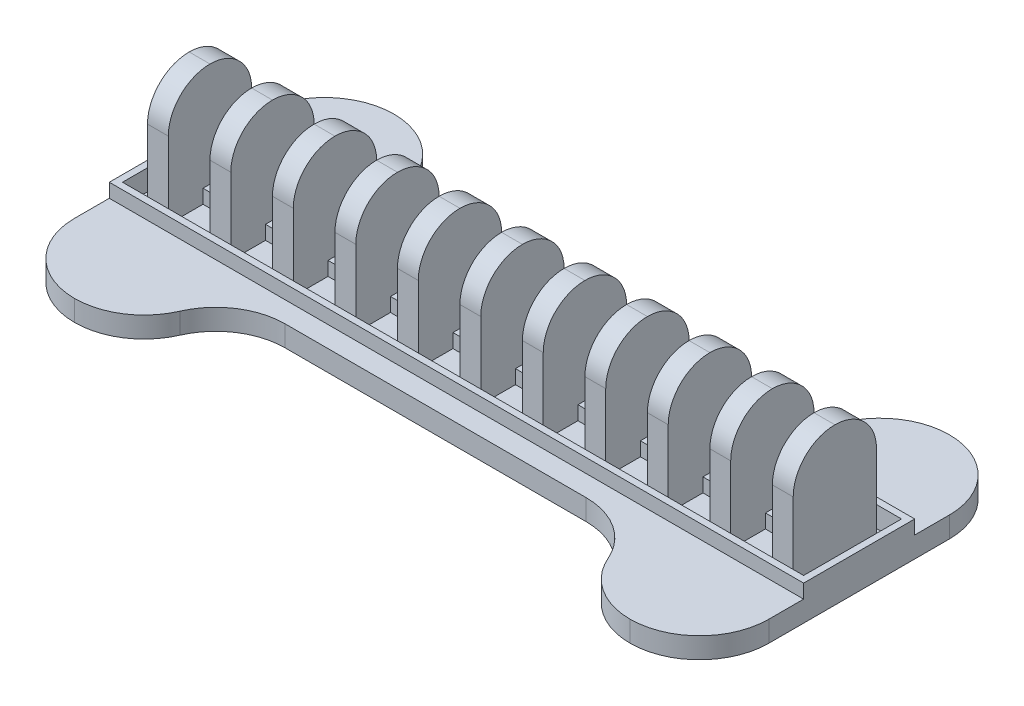
from build123d import *

# Parameters (mm, degrees)
SKETCH1_W            = 100
SKETCH1_H            = 16
BOSS_EXTRUDE1_DEPTH  = 3
SKETCH2_W            = 98
SKETCH2_H            = 14
CUT_EXTRUDE1_DEPTH   = 1
SKETCH5_W            = 20
SKETCH5_H            = 3
BOSS_EXTRUDE4_DEPTH  = 15
SKETCH6_W            = 20
SKETCH6_H            = 3
BOSS_EXTRUDE5_DEPTH  = 15
FILLET18_R           = 10
SKETCH7_W            = 3
SKETCH7_H            = 12
BOSS_EXTRUDE6_DEPTH  = 17
SKETCH8_W            = 6
SKETCH8_H            = 2
BOSS_EXTRUDE7_DEPTH  = 2
FILLET19_R           = 6
SKETCH10_W           = 60
SKETCH10_H           = 3
BOSS_EXTRUDE8_DEPTH  = 3
SKETCH11_W           = 60
SKETCH11_H           = 3
BOSS_EXTRUDE9_DEPTH  = 3
SKETCH12_W           = 0.95
SKETCH12_H           = 14
BOSS_EXTRUDE10_DEPTH = 3
SKETCH13_W           = 100
SKETCH13_H           = 0.95
BOSS_EXTRUDE11_DEPTH = 3
SKETCH14_W           = 0.95
SKETCH14_H           = 0.052088128
BOSS_EXTRUDE12_DEPTH = 3
SKETCH15_W           = 0.95
SKETCH15_H           = 0.047911872
SKETCH15_W_2         = 0.949734752
SKETCH15_H_2         = 0.052088128
BOSS_EXTRUDE13_DEPTH = 3
FILLET20_R           = 10
SKETCH17_W           = 98.1
SKETCH17_H           = 14.1
SKETCH17_W_2         = 97.1
SKETCH17_H_2         = 13.1
CUT_EXTRUDE2_DEPTH   = 4
SKETCH18_W           = 100
SKETCH18_H           = 16.05
SKETCH18_W_2         = 98
SKETCH18_H_2         = 14.05
CUT_EXTRUDE3_DEPTH   = 2
SKETCH19_W           = 100
SKETCH19_H           = 16
SKETCH19_W_2         = 98.1
SKETCH19_H_2         = 14.1
BOSS_EXTRUDE14_DEPTH = 1


with BuildPart() as part:
    # Sketch1 → Boss-Extrude1 (new body)
    with BuildSketch(Plane(origin=(0, 0, 0), x_dir=(1, 0, 0), z_dir=(0, 1, 0))):
        with Locations((50, 8)):
            Rectangle(SKETCH1_W, SKETCH1_H)
    extrude(amount=BOSS_EXTRUDE1_DEPTH)

    # Sketch2 → Cut-Extrude1 (cut)
    with BuildSketch(Plane(origin=(0, 3, 0), x_dir=(1, 0, 0), z_dir=(0, 1, 0))):
        with Locations((50, 8)):
            Rectangle(SKETCH2_W, SKETCH2_H)
    extrude(amount=-CUT_EXTRUDE1_DEPTH, mode=Mode.SUBTRACT)

    # Sketch5 → Boss-Extrude4 (add)
    with BuildSketch(Plane.XY):
        with Locations((10, 1.5)):
            Rectangle(SKETCH5_W, SKETCH5_H)
        with Locations((90, 1.5)):
            Rectangle(SKETCH5_W, SKETCH5_H)
    extrude(amount=BOSS_EXTRUDE4_DEPTH)

    # Sketch6 → Boss-Extrude5 (add)
    with BuildSketch(Plane(origin=(0, 0, -16), x_dir=(-1, 0, 0), z_dir=(0, 0, -1))):
        with Locations((-90, 1.5)):
            Rectangle(SKETCH6_W, SKETCH6_H)
        with Locations((-10, 1.5)):
            Rectangle(SKETCH6_W, SKETCH6_H)
    extrude(amount=BOSS_EXTRUDE5_DEPTH)

    # Fillet18
    fillet18_edges = [part.edges().sort_by_distance(p)[0] for p in [
        (20, 1.5, 15),
        (0, 1.5, 15),
        (80, 1.5, 15),
        (100, 1.5, 15),
        (0, 1.5, -31),
        (20, 1.5, -31),
        (80, 1.5, -31),
        (100, 1.5, -31),
    ]]
    fillet(fillet18_edges, radius=FILLET18_R - 0.0001)  # a hair under: the kernel refuses the full size

    # Sketch7 → Boss-Extrude6 (add)
    with BuildSketch(Plane(origin=(0, 2, 0), x_dir=(1, 0, 0), z_dir=(0, 1, 0))):
        with Locations((95, 8)):
            Rectangle(SKETCH7_W, SKETCH7_H)
        with Locations((86, 8)):
            Rectangle(SKETCH7_W, SKETCH7_H)
        with Locations((77, 8)):
            Rectangle(SKETCH7_W, SKETCH7_H)
        with Locations((68, 8)):
            Rectangle(SKETCH7_W, SKETCH7_H)
        with Locations((59, 8)):
            Rectangle(SKETCH7_W, SKETCH7_H)
        with Locations((50, 8)):
            Rectangle(SKETCH7_W, SKETCH7_H)
        with Locations((41, 8)):
            Rectangle(SKETCH7_W, SKETCH7_H)
        with Locations((32, 8)):
            Rectangle(SKETCH7_W, SKETCH7_H)
        with Locations((23, 8)):
            Rectangle(SKETCH7_W, SKETCH7_H)
        with Locations((14, 8)):
            Rectangle(SKETCH7_W, SKETCH7_H)
        with Locations((5, 8)):
            Rectangle(SKETCH7_W, SKETCH7_H)
    extrude(amount=BOSS_EXTRUDE6_DEPTH)

    # Sketch8 → Boss-Extrude7 (add)
    with BuildSketch(Plane(origin=(0, 2, 0), x_dir=(1, 0, 0), z_dir=(0, 1, 0))):
        with Locations((90.5, 8)):
            Rectangle(SKETCH8_W, SKETCH8_H)
        with Locations((81.5, 8)):
            Rectangle(SKETCH8_W, SKETCH8_H)
        with Locations((72.5, 8)):
            Rectangle(SKETCH8_W, SKETCH8_H)
        with Locations((63.5, 8)):
            Rectangle(SKETCH8_W, SKETCH8_H)
        with Locations((54.5, 8)):
            Rectangle(SKETCH8_W, SKETCH8_H)
        with Locations((45.5, 8)):
            Rectangle(SKETCH8_W, SKETCH8_H)
        with Locations((36.5, 8)):
            Rectangle(SKETCH8_W, SKETCH8_H)
        with Locations((27.5, 8)):
            Rectangle(SKETCH8_W, SKETCH8_H)
        with Locations((18.5, 8)):
            Rectangle(SKETCH8_W, SKETCH8_H)
        with Locations((9.5, 8)):
            Rectangle(SKETCH8_W, SKETCH8_H)
    extrude(amount=BOSS_EXTRUDE7_DEPTH)

    # Fillet19
    fillet19_edges = [part.edges().sort_by_distance(p)[0] for p in [
        (95, 19, -2),
        (95, 19, -14),
        (86, 19, -2),
        (86, 19, -14),
        (77, 19, -2),
        (77, 19, -14),
        (68, 19, -2),
        (68, 19, -14),
        (59, 19, -2),
        (59, 19, -14),
        (50, 19, -2),
        (50, 19, -14),
        (41, 19, -2),
        (41, 19, -14),
        (32, 19, -2),
        (32, 19, -14),
        (23, 19, -14),
        (23, 19, -2),
        (14, 19, -2),
        (14, 19, -14),
        (5, 19, -2),
        (5, 19, -14),
    ]]
    fillet(fillet19_edges, radius=FILLET19_R - 0.0001)  # a hair under: the kernel refuses the full size

    # Sketch10 → Boss-Extrude8 (add)
    with BuildSketch(Plane(origin=(0, 0, -16), x_dir=(-1, 0, 0), z_dir=(0, 0, -1))):
        with Locations((-50, 1.5)):
            Rectangle(SKETCH10_W, SKETCH10_H)
    extrude(amount=BOSS_EXTRUDE8_DEPTH)

    # Sketch11 → Boss-Extrude9 (add)
    with BuildSketch(Plane.XY):
        with Locations((50, 1.5)):
            Rectangle(SKETCH11_W, SKETCH11_H)
    extrude(amount=BOSS_EXTRUDE9_DEPTH)

    # Sketch12 → Boss-Extrude10 (add)
    with BuildSketch(Plane(origin=(0, 3, 0), x_dir=(1, 0, 0), z_dir=(0, 1, 0))):
        with Locations((99.525, 7.997911872)):
            Rectangle(SKETCH12_W, SKETCH12_H)
        with Locations((0.475, 7.997911872)):
            Rectangle(SKETCH12_W, SKETCH12_H)
    extrude(amount=BOSS_EXTRUDE10_DEPTH)

    # Sketch13 → Boss-Extrude11 (add)
    with BuildSketch(Plane(origin=(0, 3, 0), x_dir=(1, 0, 0), z_dir=(0, 1, 0))):
        with Locations((50, 15.525)):
            Rectangle(SKETCH13_W, SKETCH13_H)
        with Locations((50, 0.475)):
            Rectangle(SKETCH13_W, SKETCH13_H)
    extrude(amount=BOSS_EXTRUDE11_DEPTH)

    # Sketch14 → Boss-Extrude12 (add)
    with BuildSketch(Plane(origin=(0, 3, 0), x_dir=(1, 0, 0), z_dir=(0, 1, 0))):
        with Locations((0.475, 15.023955936)):
            Rectangle(SKETCH14_W, SKETCH14_H)
    extrude(amount=BOSS_EXTRUDE12_DEPTH)

    # Sketch15 → Boss-Extrude13 (add)
    with BuildSketch(Plane(origin=(0, 3, 0), x_dir=(1, 0, 0), z_dir=(0, 1, 0))):
        with Locations((0.475, 0.973955936)):
            Rectangle(SKETCH15_W, SKETCH15_H)
        with Locations((99.525132624, 0.973955936)):
            Rectangle(SKETCH15_W_2, SKETCH15_H)
        with Locations((99.525, 15.023955936)):
            Rectangle(SKETCH15_W, SKETCH15_H_2)
    extrude(amount=BOSS_EXTRUDE13_DEPTH)

    # Fillet20
    fillet20_edges = [part.edges().sort_by_distance(p)[0] for p in [
        (20, 1.5, -19),
        (80, 1.5, -19),
        (80, 1.5, 3),
        (20, 1.5, 3),
    ]]
    fillet(fillet20_edges, radius=FILLET20_R)

    # Sketch17 → Cut-Extrude2 (cut)
    with BuildSketch(Plane(origin=(0, 6, 0), x_dir=(1, 0, 0), z_dir=(0, 1, 0))):
        with Locations((50, 8)):
            Rectangle(SKETCH17_W, SKETCH17_H)
        with Locations((50, 8)):
            Rectangle(SKETCH17_W_2, SKETCH17_H_2, mode=Mode.SUBTRACT)
    extrude(amount=-CUT_EXTRUDE2_DEPTH, mode=Mode.SUBTRACT)

    # Sketch18 → Cut-Extrude3 (cut)
    with BuildSketch(Plane(origin=(0, 6, 0), x_dir=(1, 0, 0), z_dir=(0, 1, 0))):
        with Locations((50, 7.975)):
            Rectangle(SKETCH18_W, SKETCH18_H)
        with Locations((50, 7.975)):
            Rectangle(SKETCH18_W_2, SKETCH18_H_2, mode=Mode.SUBTRACT)
    extrude(amount=-CUT_EXTRUDE3_DEPTH, mode=Mode.SUBTRACT)

    # Sketch19 → Boss-Extrude14 (add)
    with BuildSketch(Plane(origin=(0, 4, 0), x_dir=(1, 0, 0), z_dir=(0, 1, 0))):
        with Locations((50, 8)):
            Rectangle(SKETCH19_W, SKETCH19_H)
        with Locations((50, 8)):
            Rectangle(SKETCH19_W_2, SKETCH19_H_2, mode=Mode.SUBTRACT)
    extrude(amount=BOSS_EXTRUDE14_DEPTH)


solid = part.part
